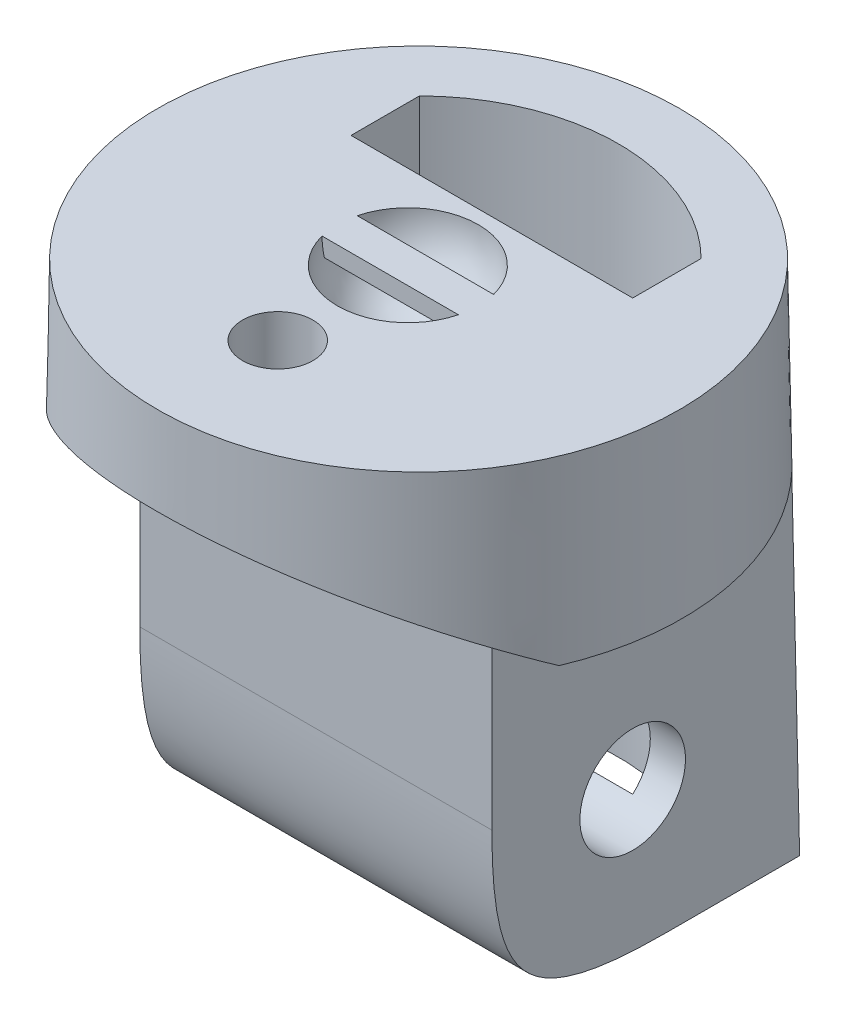
from build123d import *

# Parameters (mm, degrees)
SKETCH1_R                     = 7.5
BOSS_EXTRUDE1_DEPTH           = 15
BOSS_EXTRUDE1_TAPER           = 1
BOSS_EXTRUDE1_OTHER_WAY_DEPTH = 10
BOSS_EXTRUDE1_OTHER_WAY_TAPER = -1
CUT_EXTRUDE1_DEPTH            = 19.514790178
CUT_EXTRUDE1_DEPTH_BACK       = 19.514790178
CUT_EXTRUDE2_START            = -10.593003294
CUT_EXTRUDE2_OUTLINE_W        = 6.502745185
CUT_EXTRUDE2_OUTLINE_H        = 10
CUT_EXTRUDE2_DEPTH            = 10.593003294
SKETCH5_R                     = 1.5
CUT_EXTRUDE3_DEPTH            = 21.979721988
FILLET1_SIZE                  = 5
CUT_EXTRUDE4_DEPTH            = 19.443121582
CUT_EXTRUDE4_DEPTH_BACK       = 19.443121582
SKETCH6_W                     = 21.270993481
SKETCH6_H                     = 9.912737968
CUT_EXTRUDE5_DEPTH            = 19.514162399
SKETCH8_R                     = 1
CUT_EXTRUDE6_DEPTH            = 19.514162399
BOSS_EXTRUDE2_DEPTH           = 0.5


with BuildPart() as part:
    # Sketch1 → Boss-Extrude1 (new body)
    with BuildSketch(Plane(origin=(0, 0, 0), x_dir=(1, 0, 0), z_dir=(0, 1, 0))):
        Circle(SKETCH1_R)
    extrude(amount=BOSS_EXTRUDE1_DEPTH, taper=BOSS_EXTRUDE1_TAPER)

    # Sketch1 → Boss-Extrude1 other way (add)
    with BuildSketch(Plane(origin=(0, 0, 0), x_dir=(1, 0, 0), z_dir=(0, 1, 0))):
        Circle(SKETCH1_R)
    extrude(amount=-BOSS_EXTRUDE1_OTHER_WAY_DEPTH, taper=BOSS_EXTRUDE1_OTHER_WAY_TAPER)

    # Sketch3 → Cut-Extrude1 (cut, two sides: drawn at the far end of the back side and taken through both)
    with BuildSketch(Plane(origin=(0, 0, 0), x_dir=(0, 0, -1), z_dir=(1, 0, 0)).offset(-CUT_EXTRUDE1_DEPTH_BACK)):
        Polygon((-2.918452544, -10), (-2.918452544, 0), (-14.964340612, 6.954696718), (-14.964340612, -10), align=None)
    extrude(amount=CUT_EXTRUDE1_DEPTH + CUT_EXTRUDE1_DEPTH_BACK, mode=Mode.SUBTRACT)

    # Cut-Extrude2: read off the stored shape, not the designer's step
    # Cut-Extrude2 outline → Cut-Extrude2 (cut)
    with BuildSketch(Plane.XY.offset(2.918452544).offset(CUT_EXTRUDE2_START)):
        with Locations((-8.251372593, -5)):
            Rectangle(CUT_EXTRUDE2_OUTLINE_W, CUT_EXTRUDE2_OUTLINE_H)
        with Locations((8.251372593, -5)):
            Rectangle(CUT_EXTRUDE2_OUTLINE_W, CUT_EXTRUDE2_OUTLINE_H)
    extrude(amount=CUT_EXTRUDE2_DEPTH, mode=Mode.SUBTRACT)

    # Sketch5 → Cut-Extrude3 (cut, through all)
    with BuildSketch(Plane(origin=(5, 0, 0), x_dir=(0, 0, -1), z_dir=(1, 0, 0))):
        with Locations((1.081547456, -6)):
            Circle(SKETCH5_R)
    extrude(amount=-CUT_EXTRUDE3_DEPTH, mode=Mode.SUBTRACT)

    # Fillet1
    # a fillet whose section is not a circle: 5 mm, written as the material it takes off along each edge
    with BuildSketch(Plane(origin=(17.5, -10, 2.918452544), x_dir=(0, 0, -1), z_dir=(-1, 0, 0))) as fillet1_piece_1:
        with BuildLine():
            Bezier((FILLET1_SIZE, 0), (0, 0), (0, -FILLET1_SIZE), weights=[1, 1.5, 1])
            Line((0, -FILLET1_SIZE), (0, 0))
            Line((0, 0), (FILLET1_SIZE, 0))
        make_face()
    extrude(amount=35, mode=Mode.SUBTRACT)

    # Fillet2
    # a fillet whose section is not a circle: 10, 5 mm, written as the material it takes off along each edge
    with BuildSketch(Plane(origin=(0, 15, 0), x_dir=(1, 0, 0), z_dir=(0, 0, -1))) as fillet2_piece_1:
        with BuildLine():
            Bezier((7.411201511, 9.912737968), (7.238174026, 0), (2.411963035, 0), weights=[1, 0.818181818, 1])
            Line((2.411963035, 0), (7.238174026, 0))
            Line((7.238174026, 0), (7.411201511, 9.912737968))
        make_face()
    revolve(axis=Axis((0, 15, 0), (0, -1, 0)), mode=Mode.SUBTRACT)

    # Sketch6 → Cut-Extrude4 (cut, two sides: drawn at the far end of the back side and taken through both)
    with BuildSketch(Plane(origin=(0, 0, 0), x_dir=(0, 0, -1), z_dir=(1, 0, 0)).offset(-CUT_EXTRUDE4_DEPTH_BACK)):
        with Locations((-1.160829525, 10.043631016)):
            Rectangle(SKETCH6_W, SKETCH6_H)
    extrude(amount=CUT_EXTRUDE4_DEPTH + CUT_EXTRUDE4_DEPTH_BACK, mode=Mode.SUBTRACT)

    # Sketch7 → Cut-Extrude5 (cut, through all)
    with BuildSketch(Plane.XZ.offset(10)):
        with BuildLine():
            Line((4, -2.081547456), (4, -4.024987586))
            ThreePointArc((4, -4.024987586), (0, -5.674550649), (-4, -4.024987586))
            Line((-4, -4.024987586), (-4, -2.081547456))
            Line((-4, -2.081547456), (4, -2.081547456))
        make_face()
    extrude(amount=-CUT_EXTRUDE5_DEPTH, mode=Mode.SUBTRACT)

    # Sketch8 → Cut-Extrude6 (cut, through all)
    with BuildSketch(Plane(origin=(0, 5.087262032, 0), x_dir=(1, 0, 0), z_dir=(0, 1, 0))):
        with Locations(Location((0, -4, 0), (0, 0, 270))):
            Circle(SKETCH8_R)
    extrude(amount=-CUT_EXTRUDE6_DEPTH, mode=Mode.SUBTRACT)

    # Sketch9 → Cut-Revolve3 (revolve, cut)
    with BuildSketch(Plane(origin=(0, 5.087262032, 0), x_dir=(1, 0, 0), z_dir=(0, 1, 0))):
        with BuildLine():
            Line((-2, -0.30500636), (2, -0.30500636))
            ThreePointArc((2, -0.30500636), (0, 1.69499364), (-2, -0.30500636))
        make_face()
    revolve(axis=Axis((-2, 5.087262032, 0.30500636), (1, 0, 0)), mode=Mode.SUBTRACT)

    # Sketch10 → Boss-Extrude2 (add)
    with BuildSketch(Plane(origin=(0, 5.087262032, 0), x_dir=(1, 0, 0), z_dir=(0, 1, 0))):
        with BuildLine():
            Line((-1.936491673, -0.80500636), (1.936491673, -0.80500636))
            ThreePointArc((1.936491673, -0.80500636), (2, -0.30500636), (1.936491673, 0.19499364))
            Line((1.936491673, 0.19499364), (-1.936491673, 0.19499364))
            ThreePointArc((-1.936491673, 0.19499364), (-2, -0.30500636), (-1.936491673, -0.80500636))
        make_face()
    extrude(amount=-BOSS_EXTRUDE2_DEPTH)


solid = part.part
